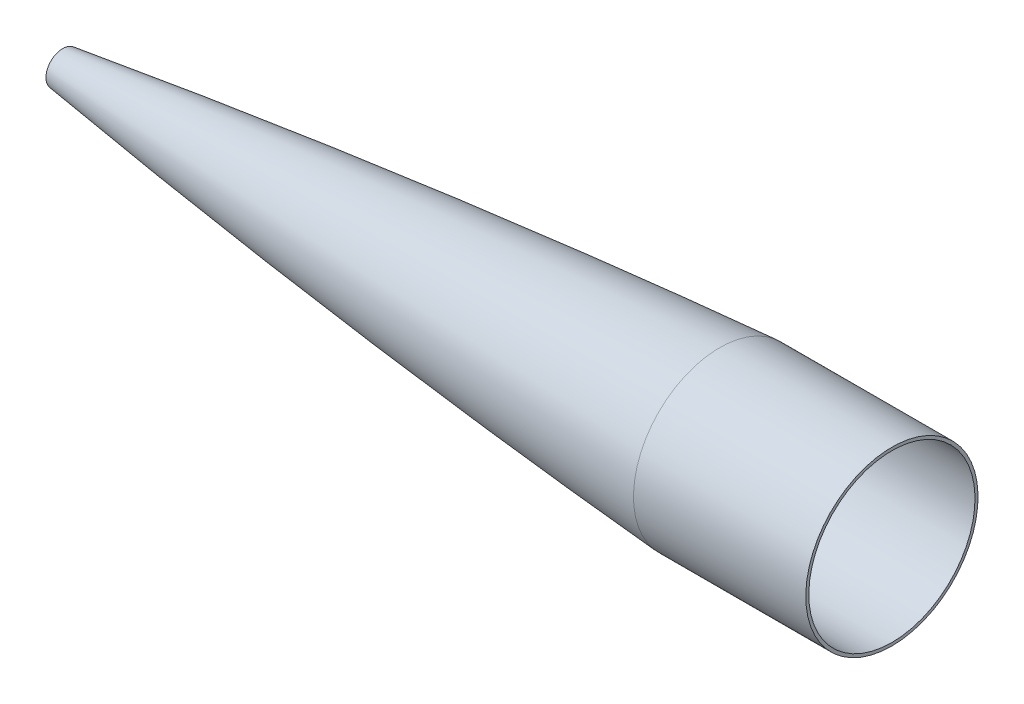
from build123d import *

# Parameters (mm, degrees)
CUT_EXTRUDE3_DEPTH = 250
SKETCH20_R         = 3
CUT_EXTRUDE4_DEPTH = 250
REVOLVE7_ANGLE     = 5
CIRPATTERN2_COUNT  = 14


with BuildPart() as part:
    # Sketch1 → Revolve1 (revolve)
    with BuildSketch(Plane(origin=(0, 0, 0), x_dir=(-1, 0, 0), z_dir=(0, 0, -1))):
        with BuildLine():
            Line((-763.382394472, 85), (-763.235294117, 85))
            ThreePointArc((-763.235294117, 85), (-380.825050597, 49.616912867), (0, 0))
            Line((0, 0), (-22.46527886, 0))
            Line((-22.46527886, 0), (-22.46527886, 0.296477795))
            ThreePointArc((-22.46527886, 0.296477795), (-392.16587196, 47.855375712), (-763.345777049, 82))
            Line((-763.345777049, 82), (-763.382394472, 82))
            Line((-763.382394472, 82), (-763.382394472, 85))
        make_face()
    revolve(axis=Axis((763.235294117, 0, 0), (-1, 0, 0)))

    # Sketch14 → Revolve4 (revolve)
    with BuildSketch(Plane(origin=(0, 0, 0), x_dir=(-1, 0, 0), z_dir=(0, 0, -1))):
        Polygon((-763.382394472, 85), (-933.235294117, 85), (-933.235294117, 82), (-763.235294117, 82), align=None)
    revolve(axis=Axis((763.235294117, 0, 0), (1, 0, 0)))

    # Sketch18 → Cut-Extrude3 (cut, symmetric)
    with BuildSketch(Plane.XY):
        Polygon((-14.456340736, 28.193165309), (-14.456340736, 18.501716749), (-14.456340736, -44.170271202), (115, -44.170271202), (115, 0), (115, 28.193165309), align=None)
    extrude(amount=CUT_EXTRUDE3_DEPTH, both=True, mode=Mode.SUBTRACT)

    # Sketch19 → Revolve6 (revolve)
    with BuildSketch(Plane.XY):
        Polygon((115, 16.506911496), (115, 0), (124.8, 0), (124.8, 17.505400014), align=None)
    revolve(axis=Axis((115, 0, 0), (1, 0, 0)))

    # Sketch20 → Cut-Extrude4 (cut, symmetric)
    with BuildSketch(Plane.ZY.offset(-115)):
        Circle(SKETCH20_R)
    extrude(amount=CUT_EXTRUDE4_DEPTH, both=True, mode=Mode.SUBTRACT)

    # Sketch21 → Revolve7 (revolve)
    with BuildSketch(Plane.XY):
        with BuildLine():
            Line((763.235294117, 85), (763.603633258, 75))
            ThreePointArc((763.603633258, 75), (443.777305757, 46.376729418), (125, 7.78656595))
            Line((125, 7.78656595), (115, 7.044178147))
            Line((115, 7.044178147), (115, 16.506911496))
            ThreePointArc((115, 16.506911496), (438.575588607, 55.883629138), (763.235294117, 85))
        make_face()
    revolve7 = revolve(axis=Axis((115, 0, 0), (1, 0, 0)), revolution_arc=REVOLVE7_ANGLE)

    # CirPattern2: Revolve7 ×14 about axis
    cirpattern2_axis = Axis((0, 0, 0), (1, 0, 0))
    for i in range(1, CIRPATTERN2_COUNT):
        add(revolve7.rotate(cirpattern2_axis, i * 360 / CIRPATTERN2_COUNT))


solid = part.part
